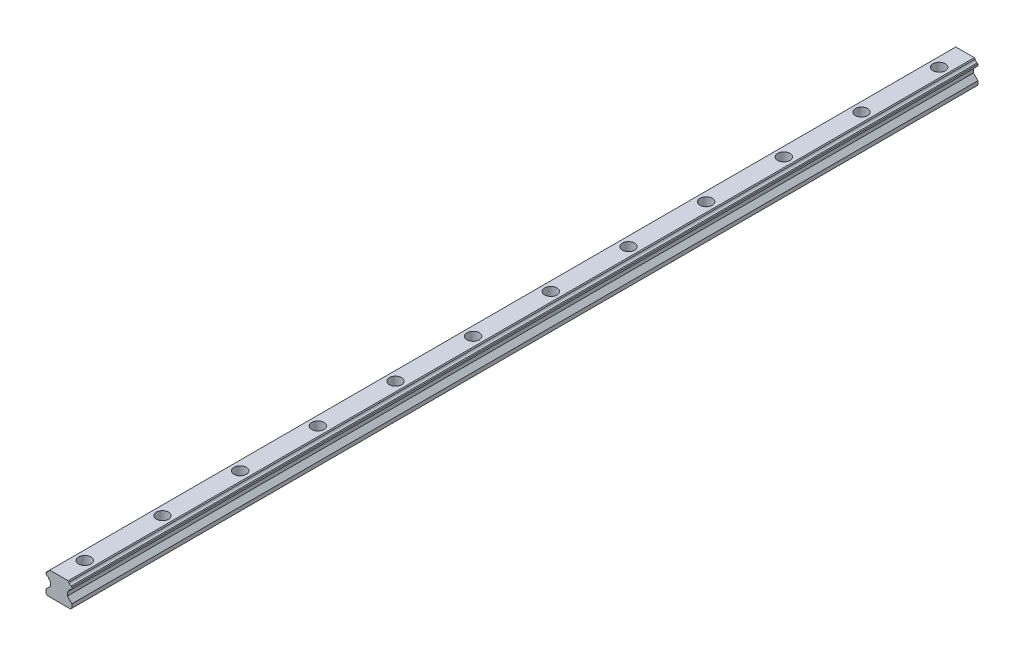
from build123d import *

# Parameters (mm, degrees)
BOSS_EXTRUDE1_DEPTH = 350
SKETCH2_R           = 3
CUT_EXTRUDE1_DEPTH  = 351.605191063
SKETCH3_R           = 4.75
CUT_EXTRUDE2_DEPTH  = 8.5
LPATTERN1_COUNT     = 100
LPATTERN1_PITCH     = 60


with BuildPart() as part:
    # Sketch1 → Boss-Extrude1 (new body)
    with BuildSketch(Plane.XY):
        with BuildLine():
            Line((-6.55, 1.465), (-6.55, -1.465))
            Line((-6.55, -1.465), (-10, -4.915))
            Line((-10, -4.915), (-10, -7.915))
            Line((-10, -7.915), (-9, -8.915))
            Line((-9, -8.915), (0, -8.915))
            Line((0, -8.915), (0, 9.085))
            Line((0, 9.085), (-7.16, 9.085))
            Line((-7.16, 9.085), (-7.768111832, 8.476888168))
            ThreePointArc((-7.768111832, 8.476888168), (-8.334356479, 7.341574733), (-9.469669914, 6.775330086))
            Line((-9.469669914, 6.775330086), (-10, 6.245))
            Line((-10, 6.245), (-10, 4.915))
            Line((-10, 4.915), (-9.469669914, 4.384669914))
            ThreePointArc((-9.469669914, 4.384669914), (-8.334356479, 3.818425267), (-7.768111832, 2.683111832))
            Line((-7.768111832, 2.683111832), (-6.55, 1.465))
        make_face()
    boss_extrude1 = extrude(amount=BOSS_EXTRUDE1_DEPTH)

    # Mirror1: Boss-Extrude1 across plane
    add(boss_extrude1.mirror(Plane(origin=(0, 9.085, 350), x_dir=(0, 0, 1), z_dir=(-1, 0, 0))))

    # Sketch2 → Cut-Extrude1 (cut, through all)
    with BuildSketch(Plane(origin=(0, 9.085, 0), x_dir=(1, 0, 0), z_dir=(0, 1, 0))):
        with Locations((0, -30)):
            Circle(SKETCH2_R)
    cut_extrude1 = extrude(amount=-CUT_EXTRUDE1_DEPTH, mode=Mode.SUBTRACT)

    # Sketch3 → Cut-Extrude2 (cut)
    with BuildSketch(Plane(origin=(0, 9.085, 0), x_dir=(1, 0, 0), z_dir=(0, 1, 0))):
        with Locations((0, -30)):
            Circle(SKETCH3_R)
    cut_extrude2 = extrude(amount=-CUT_EXTRUDE2_DEPTH, mode=Mode.SUBTRACT)

    # LPattern1: Cut-Extrude1, Cut-Extrude2 ×100
    with Locations(*[(0, 0, i * LPATTERN1_PITCH) for i in range(1, LPATTERN1_COUNT)]):
        add(cut_extrude1, mode=Mode.SUBTRACT)
        add(cut_extrude2, mode=Mode.SUBTRACT)

    # Mirror2: part across plane


with BuildPart() as part_1:
    add(part.part)
    add(part.part.mirror(Plane(origin=(-9.748570041, 2.404211705, 0), x_dir=(1, 0, 0), z_dir=(0, 0, -1))))


solid = part_1.part
